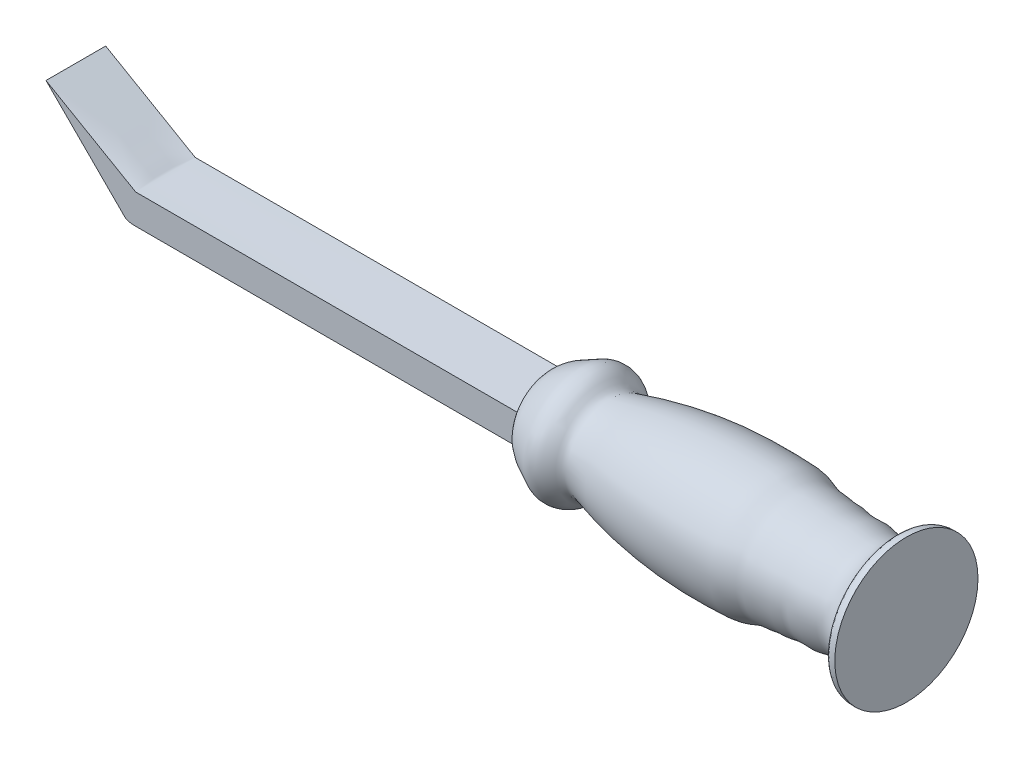
from build123d import *

# Parameters (mm, degrees)
SWEEP9_START            = -6.35
SWEEP9_DEPTH            = 12.7
CUT_EXTRUDE3_DEPTH      = 106.896218897
CUT_EXTRUDE3_DEPTH_BACK = 106.896218897


# Read off the part's stored shape, not the designer's step: Sweep9
with BuildPart() as part:
    # Sketch2 → Revolve2 (revolve)
    with BuildSketch(Plane(origin=(0, 0, 0), x_dir=(1, 0, 0), z_dir=(0, 1, 0))):
        with BuildLine():
            Line((76.2, 15.234532857), (76.2, 0))
            Line((76.2, 0), (0, 0))
            add(Edge.make_bspline(
                [(0, 0), (-0.014289391, 1.477508746), (0.166038156, 4.242535131), (-0.326008407, 7.613464171), (2.248859267, 9.905280421), (4.75236384, 10.881299996), (7.331427815, 12.366628487), (10.548485335, 11.800107252), (12.448666715, 8.78028007), (14.92963696, 9.716215681), (17.742028608, 10.473458193), (23.071490121, 11.718792526), (28.779272147, 12.563314793), (35.418965974, 13.182409845), (40.362042102, 13.299972389), (45.56838215, 13.178735478), (49.263443361, 13.094711309), (52.135800836, 11.638172959), (54.624924773, 11.709715004), (56.55814898, 11.246325334), (58.68125309, 11.360366094), (60.989342375, 10.634752517), (64.46421358, 11.339014335), (69.215818638, 9.25716668), (73.340551141, 12.181777706), (74.507206244, 15.30214845), (75.720104048, 15.243419629), (76.2, 15.234532857)],
                knots=[0, 0, 0, 0, 0.05525126, 0.078688521, 0.114575814, 0.157673263, 0.17398238, 0.21451189, 0.256403577, 0.27071977, 0.29874034, 0.358373655, 0.455777814, 0.496148444, 0.586000627, 0.624141103, 0.674585825, 0.710130609, 0.73065859, 0.758425186, 0.777505227, 0.802582219, 0.839310577, 0.89493798, 0.967427692, 0.981726829, 1, 1, 1, 1], degree=3))
        make_face()
    revolve(axis=Axis((76.2, 0, 0), (-1, 0, 0)))

    # Sweep9 outline → Sweep9 (add)
    with BuildSketch(Plane.XY.offset(SWEEP9_START)):
        with BuildLine():
            Line((-100.507001663, 14.180300595), (-103.679679798, 8.679699405))
            add(Edge.make_bspline(
                [(-103.679679798, 8.679699405), (-101.602043487, 7.48138439), (-99.523270175, 6.278138632), (-95.579237425, 4.004564718), (-93.723666738, 2.938799146), (-90.803442016, 1.24141675), (-89.711196892, 0.602027699), (-87.478935176, -0.65993852), (-86.419773454, -1.240622007), (-85.257673195, -1.963161743), (-84.987412579, -2.13858111), (-84.269532316, -2.528542077), (-83.819817593, -2.732982541), (-82.879288985, -3.029764664), (-82.367933584, -3.135770417), (-81.539762135, -3.185182463), (-81.321282614, -3.180279365), (-81.027026991, -3.174429789), (-80.954119905, -3.173137724), (-80.624821256, -3.172806324), (-80.347169202, -3.175984062), (-79.816204532, -3.178191586), (-79.551811792, -3.17856515), (-78.761923608, -3.178355692), (-78.239719194, -3.176449485), (-74.686225757, -3.166415411), (-71.644701496, -3.172366834), (-64.455135052, -3.178575314), (-60.315236439, -3.175978398), (-51.907550769, -3.173990241), (-47.637246958, -3.174701426), (-38.048514932, -3.175371748), (-32.730769295, -3.175103493), (-18.275561197, -3.174822159), (-9.137840442, -3.175130797), (0, -3.175)],
                knots=[0, 0, 0, 0, 0.068548143, 0.068548143, 0.129729314, 0.129729314, 0.165451999, 0.165451999, 0.201174684, 0.201174684, 0.208587597, 0.208587597, 0.216000509, 0.216000509, 0.223413422, 0.223413422, 0.227119878, 0.227119878, 0.230826334, 0.230826334, 0.238239247, 0.238239247, 0.245652159, 0.245652159, 0.260477984, 0.260477984, 0.347404519, 0.347404519, 0.46552865, 0.46552865, 0.587419918, 0.587419918, 0.739194137, 0.739194137, 1, 1, 1, 1], degree=3))
            Line((0, -3.175), (0, 3.175))
            add(Edge.make_bspline(
                [(-100.507001663, 14.180300595), (-99.510496046, 13.604992568), (-97.517484813, 12.454376515), (-94.528131823, 10.726955973), (-92.036368253, 9.293247898), (-90.043315774, 8.143008543), (-88.548946438, 7.276493073), (-87.055047279, 6.40568384), (-85.560046822, 5.544932212), (-84.311708345, 4.850513953), (-83.314535148, 4.281302589), (-82.692572581, 3.913941205), (-82.195895321, 3.611898165), (-81.886288436, 3.415665589), (-81.637412638, 3.269549748), (-81.451312318, 3.154880504), (-81.250342551, 3.176008037), (-80.985592354, 3.174866675), (-80.654150708, 3.178042201), (-80.125039599, 3.172204836), (-79.462965803, 3.171162755), (-78.66823778, 3.172099516), (-77.60835744, 3.175567453), (-76.283667709, 3.178434666), (-74.694282676, 3.17965975), (-72.57532398, 3.17927139), (-68.867564716, 3.174770288), (-63.570347018, 3.172164101), (-57.213020758, 3.175110518), (-50.855946946, 3.175751264), (-44.499024765, 3.175007269), (-38.142049909, 3.174744155), (-31.785030212, 3.174890699), (-23.30900076, 3.175115379), (-12.714009697, 3.17497811), (-4.238003232, 3.174992703), (0, 3.175)],
                knots=[0, 0, 0, 0, 0.03125, 0.0625, 0.09375, 0.109375, 0.125, 0.140625, 0.15625, 0.171875, 0.1796875, 0.1875, 0.19140625, 0.1953125, 0.197265625, 0.19921875, 0.201171875, 0.203125, 0.20703125, 0.2109375, 0.21875, 0.2265625, 0.234375, 0.25, 0.265625, 0.28125, 0.3125, 0.375, 0.4375, 0.5, 0.5625, 0.625, 0.6875, 0.75, 0.875, 1, 1, 1, 1], degree=3))
        make_face()
    extrude(amount=SWEEP9_DEPTH)

    # Sketch26 → Cut-Extrude3 (cut, two sides: drawn at the far end of the back side and taken through both)
    with BuildSketch(Plane.XY.offset(-CUT_EXTRUDE3_DEPTH_BACK)):
        with BuildLine():
            Line((-100.507001663, 14.180300595), (-83.492247082, -2.834453997))
            add(Edge.make_bspline(
                [(-83.492247082, -2.834453997), (-86.936743195, -23.397744075), (-116.466505117, -0.110549356), (-103.679679798, 8.679699405)],
                knots=[0, 0, 0, 0, 1, 1, 1, 1], degree=3))
            Line((-103.679679798, 8.679699405), (-100.507001663, 14.180300595))
        make_face()
    extrude(amount=CUT_EXTRUDE3_DEPTH + CUT_EXTRUDE3_DEPTH_BACK, mode=Mode.SUBTRACT)


solid = part.part
